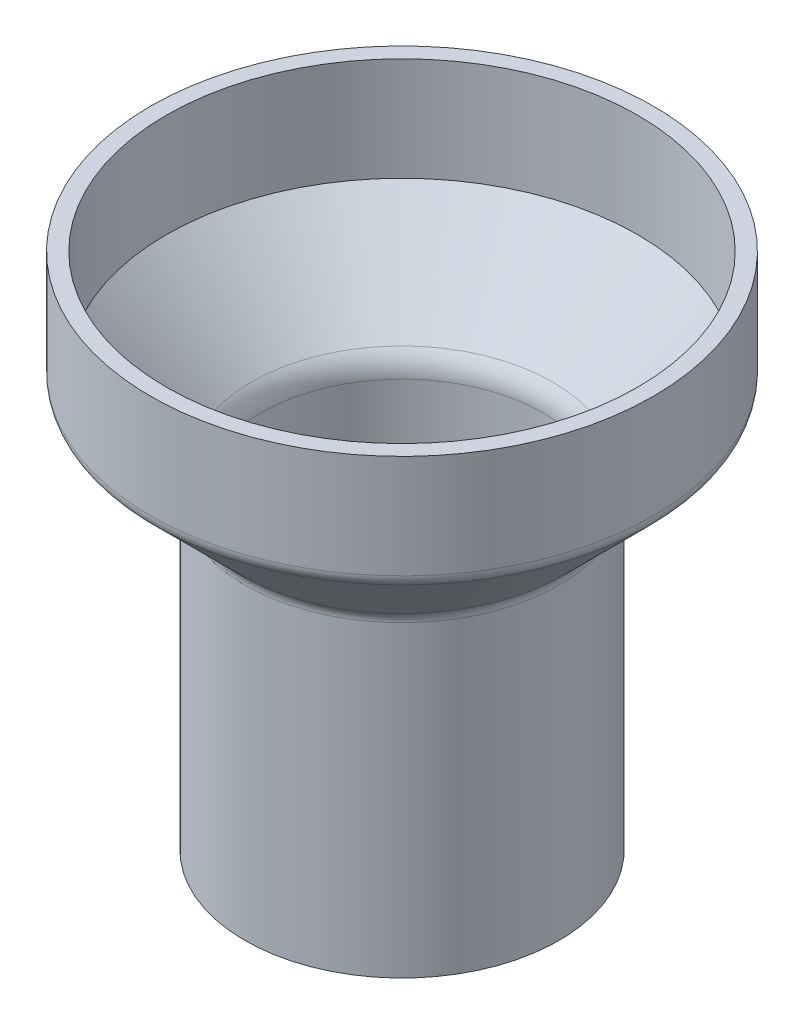
from build123d import *

# Parameters (mm, degrees)
FILLET_1_R = 1
SHELL_1_T  = -1


with BuildPart() as part:
    # Эскиз1 → Повернуть1 (revolve)
    with BuildSketch(Plane.XY):
        Polygon((0, 0), (-10, 0), (-10, 20), (-16, 26), (-16, 33), (0, 33), align=None)
    revolve(axis=Axis((0, 33, 0), (0, -1, 0)))

    # Скругление1
    fillet_1_edges = [part.edges().sort_by_distance(p)[0] for p in [
        (16, 26, 0),
        (10, 20, 0),
    ]]
    fillet(fillet_1_edges, radius=FILLET_1_R)

    # Оболочка1
    shell_1_openings = [part.faces().sort_by_distance(p)[0] for p in [
        (0, 33, 0),
        (0, 0, 0),
    ]]
    offset(amount=SHELL_1_T, openings=shell_1_openings, kind=Kind.INTERSECTION)


solid = part.part
